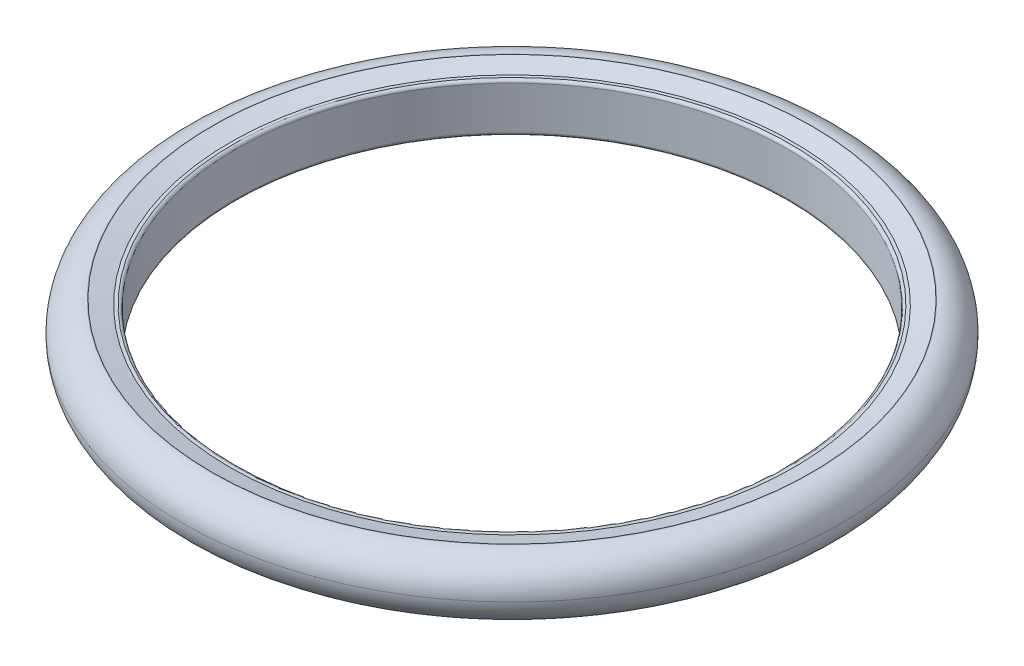
from build123d import *

# Parameters (mm, degrees)
SKETCH_1_R       = 188.695873506
SKETCH_1_R_2     = 170
EXTRUDE_4_DEPTH  = 15
SKETCH_1_8_R     = 203.2
SKETCH_1_8_R_2   = 188.695873506
EXTRUDE_5_DEPTH  = 18
CHAMFER_1_SIZE   = 15
CHAMFER_1_SIZE_2 = 4.019237886
FILLET_1_R       = 18
FILLET_2_R       = 1.75


# Some blends are built 0.0001 mm under size
with BuildPart() as part:
    # ｽｹｯﾁ1 → ﾎﾞｽ - 押し出し4 (new body)
    with BuildSketch(Plane(origin=(0, 0, 0), x_dir=(1, 0, 0), z_dir=(0, 1, 0))):
        with Locations(Location((0, 0, 0), (0, 0, 270))):
            Circle(SKETCH_1_R)
        with Locations(Location((0, 0, 0), (0, 0, 270))):
            Circle(SKETCH_1_R_2, mode=Mode.SUBTRACT)
    extrude_4 = extrude(amount=EXTRUDE_4_DEPTH)

    # ｽｹｯﾁ1<8> → ﾎﾞｽ - 押し出し5 (add)
    with BuildSketch(Plane(origin=(0, 0, 0), x_dir=(1, 0, 0), z_dir=(0, 1, 0))):
        with Locations(Location((0, 0, 0), (0, 0, 270))):
            Circle(SKETCH_1_8_R)
        with Locations(Location((0, 0, 0), (0, 0, 270))):
            Circle(SKETCH_1_8_R_2, mode=Mode.SUBTRACT)
    extrude_5 = extrude(amount=EXTRUDE_5_DEPTH)

    # ﾐﾗｰ1: ﾎﾞｽ - 押し出し4, ﾎﾞｽ - 押し出し5 across plane
    add(extrude_4.mirror(Plane.ZX))
    add(extrude_5.mirror(Plane.ZX))

    # 面取り1
    # the kernel refuses this chamfer: 15, 4.019237886 mm, written as the material it adds along each edge
    with BuildSketch(Plane(origin=(0, -15, 0), x_dir=(0, 0, 1), z_dir=(-1, 0, 0))) as chamfer_1_piece_1_section:
        Polygon((188.695873506 - CHAMFER_1_SIZE, 0), (188.695873506, -CHAMFER_1_SIZE_2), (188.695873506, 0), align=None)
    chamfer_1_piece_1 = revolve(axis=Axis((0, -15, 0), (0, 1, 0)), mode=Mode.PRIVATE)
    chamfer_1_piece_1 = split(chamfer_1_piece_1, bisect_by=Plane(origin=(0, -18, -179.092170597), z_dir=(0, 1, 0)), keep=Keep.TOP, mode=Mode.PRIVATE)
    add(chamfer_1_piece_1)
    with BuildSketch(Plane(origin=(0, 15, 0), x_dir=(0, 0, 1), z_dir=(-1, 0, 0))) as chamfer_1_piece_2_section:
        Polygon((188.695873506 - CHAMFER_1_SIZE, 0), (188.695873506, CHAMFER_1_SIZE_2), (188.695873506, 0), align=None)
    chamfer_1_piece_2 = revolve(axis=Axis((0, 15, 0), (0, 1, 0)), mode=Mode.PRIVATE)
    chamfer_1_piece_2 = split(chamfer_1_piece_2, bisect_by=Plane(origin=(0, 18, -179.092170597), z_dir=(0, -1, 0)), keep=Keep.TOP, mode=Mode.PRIVATE)
    add(chamfer_1_piece_2)

    # ﾌｨﾚｯﾄ1
    fillet_1_edges = [part.edges().sort_by_distance(p)[0] for p in [
        (0, -18, -203.2),
        (0, 18, -203.2),
    ]]
    fillet(fillet_1_edges, radius=FILLET_1_R - 0.0001)  # a hair under: the kernel refuses the full size

    # ﾌｨﾚｯﾄ2
    fillet_2_edges = [part.edges().sort_by_distance(p)[0] for p in [
        (0, -15, -170),
        (0, 15, -170),
    ]]
    fillet(fillet_2_edges, radius=FILLET_2_R)


solid = part.part
